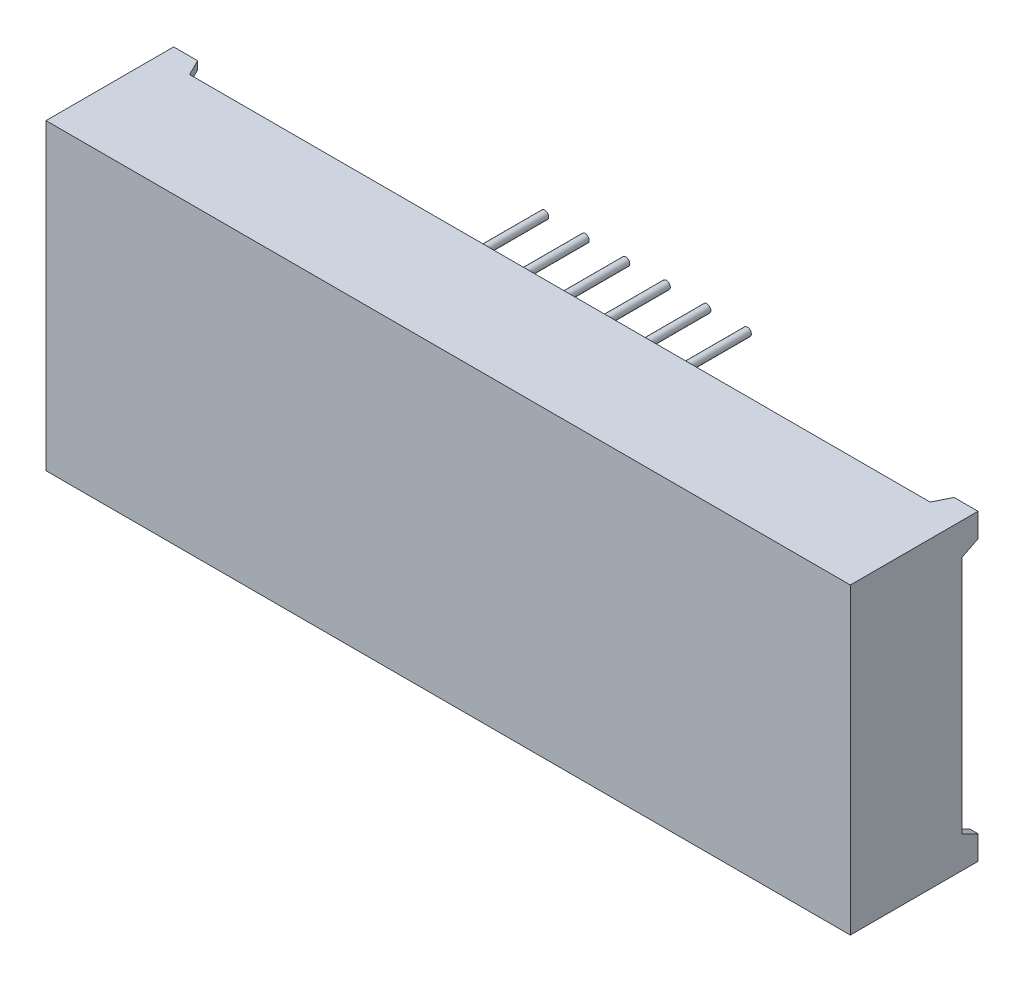
from build123d import *
from OCP.BRepFilletAPI import BRepFilletAPI_MakeChamfer

# Parameters (mm, degrees)
SKETCH1_W           = 50.4
SKETCH1_H           = 8
BOSS_EXTRUDE1_DEPTH = 19
CUT_EXTRUDE1_DEPTH  = 1
CHAMFER1_SIZE       = 0.5
CHAMFER1_SIZE_2     = 1
SKETCH3_W           = 49.4
SKETCH3_H           = 18
CUT_EXTRUDE2_DEPTH  = 0.1
SKETCH4_R           = 0.25
BOSS_EXTRUDE2_DEPTH = 5.5


with BuildPart() as part:
    # Sketch1 → Boss-Extrude1 (new body)
    with BuildSketch(Plane(origin=(0, 0, 0), x_dir=(1, 0, 0), z_dir=(0, 1, 0))):
        with Locations((25.2, 4)):
            Rectangle(SKETCH1_W, SKETCH1_H)
    extrude(amount=BOSS_EXTRUDE1_DEPTH)

    # Sketch2 → Cut-Extrude1 (cut)
    with BuildSketch(Plane(origin=(0, 0, -8), x_dir=(-1, 0, 0), z_dir=(0, 0, -1))):
        Polygon((-50.4, 17), (-49.9, 17), (-49.9, 18.5), (-48.4, 18.5), (-48.4, 19), (-2, 19), (-2, 18.5), (-0.5, 18.5), (-0.5, 17), (0, 17), (0, 2), (-0.5, 2), (-0.5, 0.5), (-2, 0.5), (-2, 0), (-48.4, 0), (-48.4, 0.5), (-49.9, 0.5), (-49.9, 2), (-50.4, 2), align=None)
    extrude(amount=-CUT_EXTRUDE1_DEPTH, mode=Mode.SUBTRACT)

    # Chamfer1
    chamfer1_edges_1 = [part.edges().sort_by_distance(p)[0] for p in [
        (50.15, 2, -8),
    ]]
    chamfer1_side_1 = [part.faces().sort_by_distance(p)[0] for p in [
        (50.15, 1.99, -8),
    ]]
    chamfer1_edges_2 = [part.edges().sort_by_distance(p)[0] for p in [
        (48.4, 0.25, -8),
    ]]
    chamfer1_side_2 = [part.faces().sort_by_distance(p)[0] for p in [
        (48.41, 0.25, -8),
    ]]
    chamfer1_edges_3 = [part.edges().sort_by_distance(p)[0] for p in [
        (2, 0.25, -8),
    ]]
    chamfer1_side_3 = [part.faces().sort_by_distance(p)[0] for p in [
        (1.99, 0.25, -8),
    ]]
    chamfer1_edges_4 = [part.edges().sort_by_distance(p)[0] for p in [
        (0.25, 2, -8),
    ]]
    chamfer1_side_4 = [part.faces().sort_by_distance(p)[0] for p in [
        (0.25, 2, -7.99),
    ]]
    chamfer1_edges_5 = [part.edges().sort_by_distance(p)[0] for p in [
        (2, 18.75, -8),
    ]]
    chamfer1_side_5 = [part.faces().sort_by_distance(p)[0] for p in [
        (1.99, 18.75, -8),
    ]]
    chamfer1_edges_6 = [part.edges().sort_by_distance(p)[0] for p in [
        (0.25, 17, -8),
    ]]
    chamfer1_side_6 = [part.faces().sort_by_distance(p)[0] for p in [
        (0.25, 17.01, -8),
    ]]
    chamfer1_edges_7 = [part.edges().sort_by_distance(p)[0] for p in [
        (48.4, 18.75, -8),
    ]]
    chamfer1_side_7 = [part.faces().sort_by_distance(p)[0] for p in [
        (48.41, 18.75, -8),
    ]]
    chamfer1_edges_8 = [part.edges().sort_by_distance(p)[0] for p in [
        (50.15, 17, -8),
    ]]
    chamfer1_side_8 = [part.faces().sort_by_distance(p)[0] for p in [
        (50.15, 17, -7.99),
    ]]
    chamfer1 = BRepFilletAPI_MakeChamfer(part.part.solid().wrapped)
    for e in chamfer1_edges_1:
        chamfer1.Add(CHAMFER1_SIZE - 0.0001, CHAMFER1_SIZE_2 - 0.0001, e.wrapped, chamfer1_side_1[0].wrapped)
    for e in chamfer1_edges_2:
        chamfer1.Add(CHAMFER1_SIZE - 0.0001, CHAMFER1_SIZE_2 - 0.0001, e.wrapped, chamfer1_side_2[0].wrapped)
    for e in chamfer1_edges_3:
        chamfer1.Add(CHAMFER1_SIZE - 0.0001, CHAMFER1_SIZE_2 - 0.0001, e.wrapped, chamfer1_side_3[0].wrapped)
    for e in chamfer1_edges_4:
        chamfer1.Add(CHAMFER1_SIZE_2 - 0.0001, CHAMFER1_SIZE - 0.0001, e.wrapped, chamfer1_side_4[0].wrapped)
    for e in chamfer1_edges_5:
        chamfer1.Add(CHAMFER1_SIZE - 0.0001, CHAMFER1_SIZE_2 - 0.0001, e.wrapped, chamfer1_side_5[0].wrapped)
    for e in chamfer1_edges_6:
        chamfer1.Add(CHAMFER1_SIZE - 0.0001, CHAMFER1_SIZE_2 - 0.0001, e.wrapped, chamfer1_side_6[0].wrapped)
    for e in chamfer1_edges_7:
        chamfer1.Add(CHAMFER1_SIZE - 0.0001, CHAMFER1_SIZE_2 - 0.0001, e.wrapped, chamfer1_side_7[0].wrapped)
    for e in chamfer1_edges_8:
        chamfer1.Add(CHAMFER1_SIZE_2 - 0.0001, CHAMFER1_SIZE - 0.0001, e.wrapped, chamfer1_side_8[0].wrapped)
    add(Compound.cast(chamfer1.Shape()), mode=Mode.REPLACE)  # a hair under: the kernel refuses the full size

    # Sketch3 → Cut-Extrude2 (cut)
    with BuildSketch(Plane(origin=(0, 0, -7), x_dir=(-1, 0, 0), z_dir=(0, 0, -1))):
        with Locations((-25.2, 9.5)):
            Rectangle(SKETCH3_W, SKETCH3_H)
    extrude(amount=-CUT_EXTRUDE2_DEPTH, mode=Mode.SUBTRACT)

    # Sketch4 → Boss-Extrude2 (add)
    with BuildSketch(Plane(origin=(0, 0, -6.9), x_dir=(-1, 0, 0), z_dir=(0, 0, -1))):
        with Locations(Location((-31.55, 17.12, 0), (0, 0, 180))):
            Circle(SKETCH4_R)
        with Locations(Location((-29.01, 17.12, 0), (0, 0, 180))):
            Circle(SKETCH4_R)
        with Locations(Location((-26.47, 17.12, 0), (0, 0, 180))):
            Circle(SKETCH4_R)
        with Locations(Location((-23.93, 17.12, 0), (0, 0, 180))):
            Circle(SKETCH4_R)
        with Locations(Location((-21.39, 17.12, 0), (0, 0, 180))):
            Circle(SKETCH4_R)
        with Locations(Location((-18.85, 17.12, 0), (0, 0, 180))):
            Circle(SKETCH4_R)
        with Locations(Location((-31.55, 1.88, 0), (0, 0, 180))):
            Circle(SKETCH4_R)
        with Locations(Location((-29.01, 1.88, 0), (0, 0, 180))):
            Circle(SKETCH4_R)
        with Locations(Location((-26.47, 1.88, 0), (0, 0, 180))):
            Circle(SKETCH4_R)
        with Locations(Location((-23.93, 1.88, 0), (0, 0, 180))):
            Circle(SKETCH4_R)
        with Locations(Location((-21.39, 1.88, 0), (0, 0, 180))):
            Circle(SKETCH4_R)
        with Locations(Location((-18.85, 1.88, 0), (0, 0, 180))):
            Circle(SKETCH4_R)
    extrude(amount=BOSS_EXTRUDE2_DEPTH)


solid = part.part
